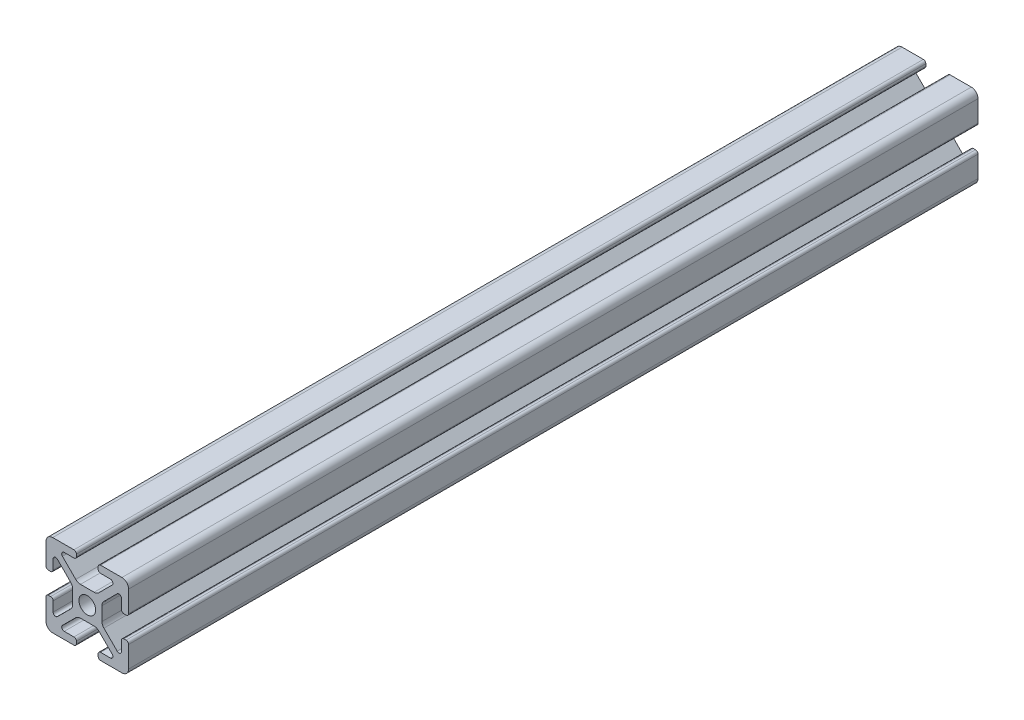
from build123d import *

# Parameters (mm, degrees)
SKETCH2_W            = 8.76
SKETCH2_H            = 8.76
SKETCH2_R            = 2.5
BOSS_EXTRUDE1_DEPTH  = 127
BOSS_EXTRUDE2_START  = -127
BOSS_EXTRUDE2_DEPTH  = 254
FILLET1_R            = 0.75
FILLET1_OF_MIRROR1_R = 0.75
MIRROR2_START        = -127
MIRROR2_DEPTH        = 254
FILLET2_R            = 2


# Read off the part's stored shape, not the designer's step: Mirror2
with BuildPart() as part:
    # Sketch2 → Boss-Extrude1 (new, symmetric)
    with BuildSketch(Plane.XY):
        Rectangle(SKETCH2_W, SKETCH2_H)
        Circle(SKETCH2_R, mode=Mode.SUBTRACT)
    extrude(amount=BOSS_EXTRUDE1_DEPTH, both=True)

    # Sketch3 → Boss-Extrude2 (add)
    with BuildSketch(Plane.XY.offset(BOSS_EXTRUDE2_START)):
        Polygon((3.25, 12.35), (12.35, 12.35), (12.35, 3.25), (10.22, 3.25), (10.22, 8.713862556), (4.38, 2.873862556), (4.38, 4.38), (2.873862556, 4.38), (8.713862556, 10.22), (3.25, 10.22), align=None)
    boss_extrude2 = extrude(amount=BOSS_EXTRUDE2_DEPTH)

    # Fillet1
    fillet1_edges = [part.edges().sort_by_distance(p)[0] for p in [
        (3.25, 12.35, 0),
        (3.25, 10.22, 0),
        (8.713862556, 10.22, 0),
        (10.22, 8.713862556, 0),
        (10.22, 3.25, 0),
        (12.35, 3.25, 0),
    ]]
    fillet(fillet1_edges, radius=FILLET1_R)

    # Mirror1: Boss-Extrude2 across plane
    add(boss_extrude2.mirror(Plane.ZX))

    # Fillet1 of Mirror1
    fillet1_of_mirror1_edges = [part.edges().sort_by_distance(p)[0] for p in [
        (3.25, -12.35, 0),
        (3.25, -10.22, 0),
        (8.713862556, -10.22, 0),
        (10.22, -8.713862556, 0),
        (10.22, -3.25, 0),
        (12.35, -3.25, 0),
    ]]
    fillet(fillet1_of_mirror1_edges, radius=FILLET1_OF_MIRROR1_R)

    # Mirror2 outline → Mirror2 (add)
    with BuildSketch(Plane.XY.offset(MIRROR2_START)):
        with BuildLine():
            ThreePointArc((-7.43353247, 8.939669914), (-7.596112034, 9.757012574), (-6.903202384, 10.22))
            Line((-6.903202384, 10.22), (-4, 10.22))
            ThreePointArc((-4, 10.22), (-3.469669914, 10.439669914), (-3.25, 10.97))
            Line((-3.25, 10.97), (-3.25, 11.6))
            ThreePointArc((-3.25, 11.6), (-3.469669914, 12.130330086), (-4, 12.35))
            Line((-4, 12.35), (-12.35, 12.35))
            Line((-12.35, 12.35), (-12.35, 4))
            ThreePointArc((-12.35, 4), (-12.130330086, 3.469669914), (-11.6, 3.25))
            Line((-11.6, 3.25), (-10.97, 3.25))
            ThreePointArc((-10.97, 3.25), (-10.439669914, 3.469669914), (-10.22, 4))
            Line((-10.22, 4), (-10.22, 6.903202384))
            ThreePointArc((-10.22, 6.903202384), (-9.757012574, 7.596112034), (-8.939669914, 7.43353247))
            Line((-8.939669914, 7.43353247), (-4.38, 2.873862556))
            Line((-4.38, 2.873862556), (-4.38, 4.38))
            Line((-4.38, 4.38), (-2.873862556, 4.38))
            Line((-2.873862556, 4.38), (-7.43353247, 8.939669914))
        make_face()
        with BuildLine():
            Line((-4.38, -4.38), (-4.38, -2.873862556))
            Line((-4.38, -2.873862556), (-8.939669914, -7.43353247))
            ThreePointArc((-8.939669914, -7.43353247), (-9.757012574, -7.596112034), (-10.22, -6.903202384))
            Line((-10.22, -6.903202384), (-10.22, -4))
            ThreePointArc((-10.22, -4), (-10.439669914, -3.469669914), (-10.97, -3.25))
            Line((-10.97, -3.25), (-11.6, -3.25))
            ThreePointArc((-11.6, -3.25), (-12.130330086, -3.469669914), (-12.35, -4))
            Line((-12.35, -4), (-12.35, -12.35))
            Line((-12.35, -12.35), (-4, -12.35))
            ThreePointArc((-4, -12.35), (-3.469669914, -12.130330086), (-3.25, -11.6))
            Line((-3.25, -11.6), (-3.25, -10.97))
            ThreePointArc((-3.25, -10.97), (-3.469669914, -10.439669914), (-4, -10.22))
            Line((-4, -10.22), (-6.903202384, -10.22))
            ThreePointArc((-6.903202384, -10.22), (-7.596112034, -9.757012574), (-7.43353247, -8.939669914))
            Line((-7.43353247, -8.939669914), (-2.873862556, -4.38))
            Line((-2.873862556, -4.38), (-4.38, -4.38))
        make_face()
    extrude(amount=MIRROR2_DEPTH)

    # Fillet2
    fillet2_edges = [part.edges().sort_by_distance(p)[0] for p in [
        (-2.873862556, -4.38, 0),
        (-4.38, -2.873862556, 0),
        (-12.35, -12.35, 0),
        (2.873862556, 4.38, 0),
        (4.38, 2.873862556, 0),
        (12.35, 12.35, 0),
        (-2.873862556, 4.38, 0),
        (-4.38, 2.873862556, 0),
        (-12.35, 12.35, 0),
        (2.873862556, -4.38, 0),
        (4.38, -2.873862556, 0),
        (12.35, -12.35, 0),
    ]]
    fillet(fillet2_edges, radius=FILLET2_R)


solid = part.part
